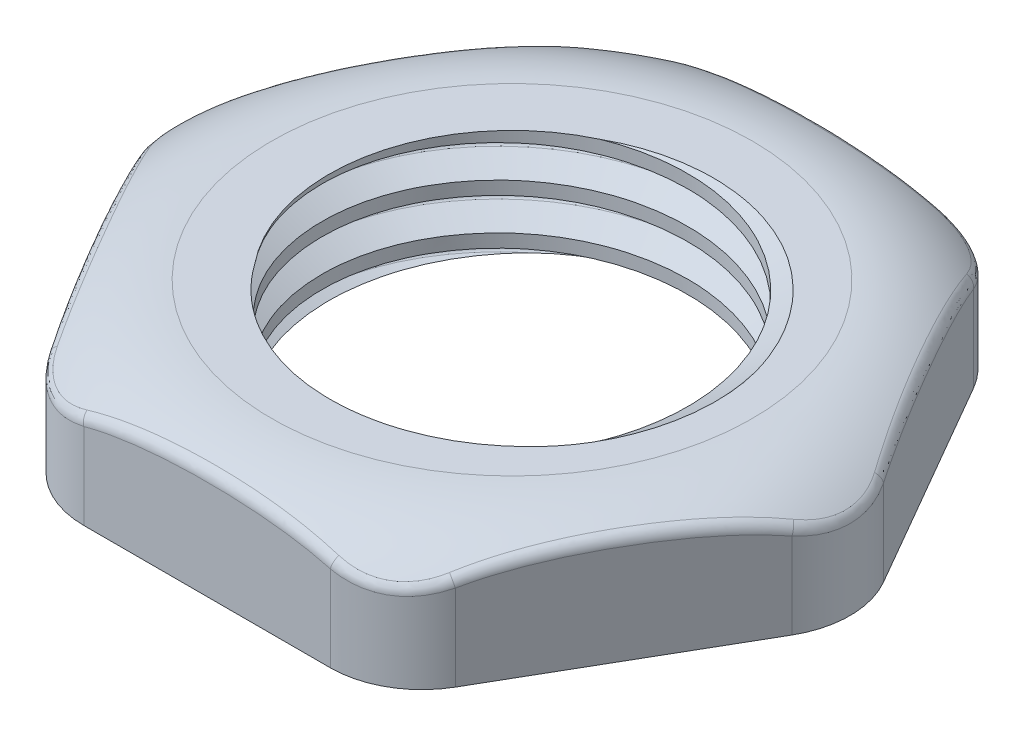
from build123d import *

# Parameters (mm, degrees)
ESQUISSE1_R                           = 3
BOSS_EXTRU_1_DEPTH                    = 2
ENL_VEMENT_DE_MATI_RE_BALAYAGE1_PITCH = 0.75
CONG_1_R                              = 1.5
CONG_2_R                              = 0.2


with BuildPart() as part:
    # Esquisse1 → Boss.-Extru.1 (new body)
    with BuildSketch(Plane(origin=(0, 0, 0), x_dir=(1, 0, 0), z_dir=(0, 1, 0))):
        Polygon((2.886751346, 5), (-2.886751346, 5), (-5.773502692, 0), (-2.886751346, -5), (2.886751346, -5), (5.773502692, 0), align=None)
        with Locations(Location((0, 0, 0), (0, 0, 270))):
            Circle(ESQUISSE1_R, mode=Mode.SUBTRACT)
    extrude(amount=BOSS_EXTRU_1_DEPTH)

    # Enlèvement de matière-Balayage1: the profile of Esquisse2 screwed along a right-hand helix of 9.25 turns, 8 arcs to a turn; built about Z, then put on its axis
    enl_vement_de_mati_re_balayage1_z = Axis((0, 0, 0), (0, 0, 1))
    enl_vement_de_mati_re_balayage1_corners = [(0, 2.76635, -0.802808483), (0, 3.375, -0.451404241), (0, 3.403867513, -0.401404241), (0, 3.375, -0.351404241), (0, 2.76635, 0)]
    with BuildLine(mode=Mode.PRIVATE) as enl_vement_de_mati_re_balayage1_profile:
        Line(enl_vement_de_mati_re_balayage1_corners[0], enl_vement_de_mati_re_balayage1_corners[1])
        Line(enl_vement_de_mati_re_balayage1_corners[3], enl_vement_de_mati_re_balayage1_corners[4])
        Line(enl_vement_de_mati_re_balayage1_corners[4], enl_vement_de_mati_re_balayage1_corners[0])
        ThreePointArc((0, 3.375, -0.451404241), (0, 3.396132487, -0.430271755), (0, 3.403867513, -0.401404241))
        ThreePointArc((0, 3.403867513, -0.401404241), (0, 3.396132487, -0.372536728), (0, 3.375, -0.351404241))
    enl_vement_de_mati_re_balayage1_cap = Face(enl_vement_de_mati_re_balayage1_profile.wire())
    enl_vement_de_mati_re_balayage1_arcs = [((0, 3.375, -0.451404241), (0, 3.403867513, -0.434737575), (0, 3.403867513, -0.401404241), (1, 0.8660254037844441, 1)), ((0, 3.403867513, -0.401404241), (0, 3.403867513, -0.368070908), (0, 3.375, -0.351404241), (1, 0.8660254037844441, 1))]  # start, shoulder, end, weights
    enl_vement_de_mati_re_balayage1_turn_angles = [0, 22.5, 45, 67.5, 90, 112.5, 135, 157.5, 180, 202.5, 225, 247.5, 270, 292.5, 315, 337.5, 360]
    enl_vement_de_mati_re_balayage1_turn_weights = [1, 0.9238795325112867, 1, 0.9238795325112867, 1, 0.9238795325112867, 1, 0.9238795325112867, 1, 0.9238795325112867, 1, 0.9238795325112867, 1, 0.9238795325112867, 1, 0.9238795325112867, 1]
    enl_vement_de_mati_re_balayage1_turn_rails = [Edge.make_bspline([Vector(p[0], p[1], 0).rotate(enl_vement_de_mati_re_balayage1_z, enl_vement_de_mati_re_balayage1_turn_angles[k]) / enl_vement_de_mati_re_balayage1_turn_weights[k] + Vector(0, 0, p[2] + ENL_VEMENT_DE_MATI_RE_BALAYAGE1_PITCH * enl_vement_de_mati_re_balayage1_turn_angles[k] / 360) for k in range(17)], [0, 0, 0, 1, 1, 2, 2, 3, 3, 4, 4, 5, 5, 6, 6, 7, 7, 8, 8, 8], 2, enl_vement_de_mati_re_balayage1_turn_weights) for p in enl_vement_de_mati_re_balayage1_corners]
    enl_vement_de_mati_re_balayage1_turn_sides = [*[Face.make_surface_from_curves(enl_vement_de_mati_re_balayage1_turn_rails[p[0]], enl_vement_de_mati_re_balayage1_turn_rails[p[1]]) for p in [(0, 1), (3, 4), (4, 0)]], *[Face.make_bezier_surface([[Vector(p[j][0], p[j][1], 0).rotate(enl_vement_de_mati_re_balayage1_z, enl_vement_de_mati_re_balayage1_turn_angles[2 * i + k]) / enl_vement_de_mati_re_balayage1_turn_weights[2 * i + k] + Vector(0, 0, p[j][2] + ENL_VEMENT_DE_MATI_RE_BALAYAGE1_PITCH * enl_vement_de_mati_re_balayage1_turn_angles[2 * i + k] / 360) for k in range(3)] for j in range(3)], [[p[3][j] * enl_vement_de_mati_re_balayage1_turn_weights[2 * i + k] for k in range(3)] for j in range(3)]) for p in enl_vement_de_mati_re_balayage1_arcs for i in range(8)]]
    enl_vement_de_mati_re_balayage1_last_angles = [3240, 3262.5, 3285, 3307.5, 3330]
    enl_vement_de_mati_re_balayage1_last_weights = [1, 0.9238795325112867, 1, 0.9238795325112306, 1]
    enl_vement_de_mati_re_balayage1_last_rails = [Edge.make_bspline([Vector(p[0], p[1], 0).rotate(enl_vement_de_mati_re_balayage1_z, enl_vement_de_mati_re_balayage1_last_angles[k]) / enl_vement_de_mati_re_balayage1_last_weights[k] + Vector(0, 0, p[2] + ENL_VEMENT_DE_MATI_RE_BALAYAGE1_PITCH * enl_vement_de_mati_re_balayage1_last_angles[k] / 360) for k in range(5)], [0, 0, 0, 1, 1, 2, 2, 2], 2, enl_vement_de_mati_re_balayage1_last_weights) for p in enl_vement_de_mati_re_balayage1_corners]
    enl_vement_de_mati_re_balayage1_last_sides = [*[Face.make_surface_from_curves(enl_vement_de_mati_re_balayage1_last_rails[p[0]], enl_vement_de_mati_re_balayage1_last_rails[p[1]]) for p in [(0, 1), (3, 4), (4, 0)]], *[Face.make_bezier_surface([[Vector(p[j][0], p[j][1], 0).rotate(enl_vement_de_mati_re_balayage1_z, enl_vement_de_mati_re_balayage1_last_angles[2 * i + k]) / enl_vement_de_mati_re_balayage1_last_weights[2 * i + k] + Vector(0, 0, p[j][2] + ENL_VEMENT_DE_MATI_RE_BALAYAGE1_PITCH * enl_vement_de_mati_re_balayage1_last_angles[2 * i + k] / 360) for k in range(3)] for j in range(3)], [[p[3][j] * enl_vement_de_mati_re_balayage1_last_weights[2 * i + k] for k in range(3)] for j in range(3)]) for p in enl_vement_de_mati_re_balayage1_arcs for i in range(2)]]
    enl_vement_de_mati_re_balayage1 = Plane(origin=(0, 2, 0), x_dir=(0, 0, 1), z_dir=(0, -1, 0)) * Solid(Shell([*[p.moved(Location((0, 0, ENL_VEMENT_DE_MATI_RE_BALAYAGE1_PITCH * i))) for i in range(9) for p in enl_vement_de_mati_re_balayage1_turn_sides], *enl_vement_de_mati_re_balayage1_last_sides, enl_vement_de_mati_re_balayage1_cap, enl_vement_de_mati_re_balayage1_cap.rotate(enl_vement_de_mati_re_balayage1_z, 3330).moved(Location((0, 0, ENL_VEMENT_DE_MATI_RE_BALAYAGE1_PITCH * 3330 / 360)))]))
    add(enl_vement_de_mati_re_balayage1, mode=Mode.SUBTRACT)

    # Congé1
    cong_1_edges = [part.edges().sort_by_distance(p)[0] for p in [
        (5.773502692, 1, 0),
        (2.886751346, 1, 5),
        (-2.886751346, 1, 5),
        (-5.773502692, 1, 0),
        (-2.886751346, 1, -5),
        (2.886751346, 1, -5),
    ]]
    fillet(cong_1_edges, radius=CONG_1_R)

    # Esquisse4 → Enlèvement de matière-Révolution1 (revolve, cut)
    with BuildSketch(Plane.XY, mode=Mode.PRIVATE) as enl_vement_de_mati_re_r_volution1_sk:
        with BuildLine():
            Line((-5.541451884, 1.4), (-5.541451884, 2))
            Line((-5.541451884, 2), (-3.941451884, 2))
            ThreePointArc((-3.941451884, 2), (-4.795852259, 1.845067665), (-5.541451884, 1.4))
        make_face()
    revolve(enl_vement_de_mati_re_r_volution1_sk.sketch.rotate(Axis((0, 0, 0), (0, 1, 0)), 270), axis=Axis((0, 0, 0), (0, 1, 0)), mode=Mode.SUBTRACT)

    # Congé2
    cong_2_edges = [part.edges().sort_by_distance(p)[0] for p in [
        (5.541451884, 1.4, 0),
        (2.405048817, 1.432628042, 4.949929627),
        (-2.770725942, 1.4, 4.799038106),
        (-5.541451884, 1.4, 8.3e-08),
        (3.084240378, 1.432628039, -4.557798203),
        (-2.770725942, 1.4, -4.799038106),
    ]]
    fillet(cong_2_edges, radius=CONG_2_R)


solid = part.part
